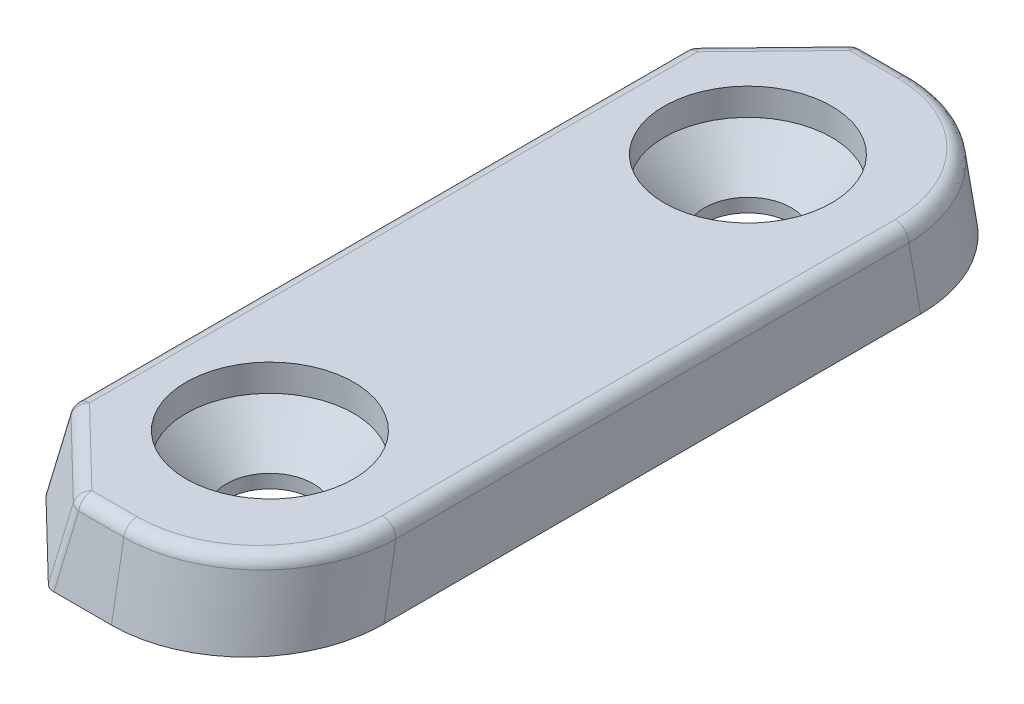
from build123d import *
from OCP.BRepFilletAPI import BRepFilletAPI_MakeChamfer

# Parameters (mm, degrees)
EXTRUDE_1_DEPTH     = 3
EXTRUDE_1_TAPER     = 10.000000000000021
EXTRUDE_3_DEPTH     = 3
CUT_EXTRUDE_3_DEPTH = 17.82260394825962
SKETCH_6_R          = 1.6
CUT_EXTRUDE_2_DEPTH = 21.832600617678803
SKETCH_9_R          = 3.1000000000000005
CUT_EXTRUDE_4_DEPTH = 1
CHAMFER_1_SIZE      = 1.5
FILLET_2_R          = 5
CHAMFER_2_SIZE      = 3
CHAMFER_2_SIZE2     = 3.094724616911856
CHAMFER_2_SIZE2_2   = 3.0947246169118565
FILLET_1_R          = 0.5


with BuildPart() as part:
    # Эскиз1 → Бобышка-Вытянуть1 (new body)
    with BuildSketch(Plane(origin=(0, 0, 0), x_dir=(1, 0, 0), z_dir=(0, 1, 0))):
        Polygon((3.6710190578746005, 14.999999999999998), (3.6710190578746094, -15.000000000000004), (7.67101905787461, -15.000000000000002), (7.6710190578746005, 14.999999999999998), align=None)
    extrude(amount=EXTRUDE_1_DEPTH, taper=EXTRUDE_1_TAPER)


with BuildPart() as body_2:
    # Эскиз2 → Бобышка-Вытянуть3 (new body)
    with BuildSketch(Plane(origin=(0, 0, 0), x_dir=(1, 0, 0), z_dir=(0, 1, 0))):
        Polygon((7.142038115749204, 14.471019057874603), (7.142038115749204, 14.999999999999998), (14.142038115749205, 14.999999999999996), (14.142038115749209, -15.000000000000004), (7.142038115749207, -15.000000000000004), (7.142038115749214, -14.471019057874607), align=None)
    extrude(amount=EXTRUDE_3_DEPTH)

    # Эскиз8 → Вырез-Вытянуть3 (cut, through all)
    with BuildSketch(Plane.ZY.offset(-7.142038115749204)):
        Polygon((-14.999999999999998, 2.999999999999999), (-14.999999999999998, 0), (-14.471019057874603, 3), align=None)
        Polygon((14.471019057874607, 3), (15.000000000000004, 0), (15, 2.999999999999999), align=None)
    extrude(amount=-CUT_EXTRUDE_3_DEPTH, mode=Mode.SUBTRACT)


with BuildPart() as part_1:
    add(part.part)

    # Combine 1: union body 2
    add(body_2.part)

    # Эскиз6 → Вырез-Вытянуть2 (cut, through all)
    with BuildSketch(Plane(origin=(0, 3, 0), x_dir=(1, 1.64e-15, 0), z_dir=(-1.64e-15, 1, 0))):
        with Locations(Location((8.838834764831857, 8.83883476483183, 0), (0, 0, 180))):
            Circle(SKETCH_6_R)
        with Locations(Location((8.838834764831846, -8.83883476483184, 0), (0, 0, 180))):
            Circle(SKETCH_6_R)
    extrude(amount=-CUT_EXTRUDE_2_DEPTH, mode=Mode.SUBTRACT)

    # Эскиз9 → Вырез-Вытянуть4 (cut)
    with BuildSketch(Plane(origin=(0, 3, 0), x_dir=(1, 0, 0), z_dir=(0, 1, 0))):
        with Locations(Location((8.838834764831857, 8.83883476483183, 0), (0, 0, 270))):
            Circle(SKETCH_9_R)
        with Locations(Location((8.838834764831846, -8.83883476483184, 0), (0, 0, 270))):
            Circle(SKETCH_9_R)
    extrude(amount=-CUT_EXTRUDE_4_DEPTH, mode=Mode.SUBTRACT)

    # Фаска1
    chamfer_1_edges = [part_1.edges().sort_by_distance(p)[0] for p in [
        (10.438834764831858, 2.0000000000000027, -8.83883476483183),
        (10.438834764831848, 2.0000000000000027, 8.83883476483184),
    ]]
    chamfer(chamfer_1_edges, length=CHAMFER_1_SIZE - 0.0001)  # a hair under: the kernel refuses the full size

    # Скругление2
    fillet_2_edges = [part_1.edges().sort_by_distance(p)[0] for p in [
        (14.142038115749205, 1.5000000000000049, -14.7355095289373),
        (14.142038115749209, 1.5, 14.735509528937309),
    ]]
    fillet(fillet_2_edges, radius=FILLET_2_R)

    # Фаска2: one chamfer whose edges measure the first distance from different faces: ONE call of the kernel's chamfer builder (chamfer() names one face for all edges)
    chamfer_2_edges_1 = [part_1.edges().sort_by_distance(p)[0] for p in [
        (3.9355095289373074, 1.5, 14.735509528937303),
    ]]
    chamfer_2_side_1 = [part_1.faces().sort_by_distance(p)[0] for p in [
        (3.9339270656333682, 1.4910254046341833, 4.6e-16),
    ]]
    chamfer_2_edges_2 = [part_1.edges().sort_by_distance(p)[0] for p in [
        (3.9355095289372986, 1.5, -14.7355095289373),
    ]]
    chamfer_2_side_2 = [part_1.faces().sort_by_distance(p)[0] for p in [
        (6.536534479688592, 1.4746001134294486, -14.739988214246614),
    ]]
    chamfer_2 = BRepFilletAPI_MakeChamfer(part_1.part.solid().wrapped)
    for e in chamfer_2_edges_1:
        chamfer_2.Add(CHAMFER_2_SIZE, CHAMFER_2_SIZE2, e.wrapped, chamfer_2_side_1[0].wrapped)  # the first distance lies on this face
    for e in chamfer_2_edges_2:
        chamfer_2.Add(CHAMFER_2_SIZE, CHAMFER_2_SIZE2_2, e.wrapped, chamfer_2_side_2[0].wrapped)  # the first distance lies on this face
    add(Compound.cast(chamfer_2.Shape()), mode=Mode.REPLACE)

    # Скругление1
    fillet_1_edges = [part_1.edges().sort_by_distance(p)[0] for p in [
        (14.142038115749207, 3, 1.78e-15),
        (8.193466364554162, 3, -14.471019057874603),
        (12.691076133990677, 3, -12.970196202352879),
        (12.691076133990677, 3, 12.970196202352883),
        (4.200000000000001, 3, 0.0480710792979236),
        (3.935509528937306, 1.4999999999999996, 11.690614915578193),
        (3.9355095289372994, 1.5, -11.594472756982334),
        (6.980404142296417, 1.4999999999999982, -14.735509528937293),
        (8.241537443852085, 3, 14.471019057874605),
        (5.77051838597748, 3, 12.948571751195045),
        (5.722447306679558, 3, -12.900500671897117),
        (7.076546300892258, 1.4999999999999976, 14.735509528937294),
    ]]
    fillet(fillet_1_edges, radius=FILLET_1_R)


solid = part_1.part
